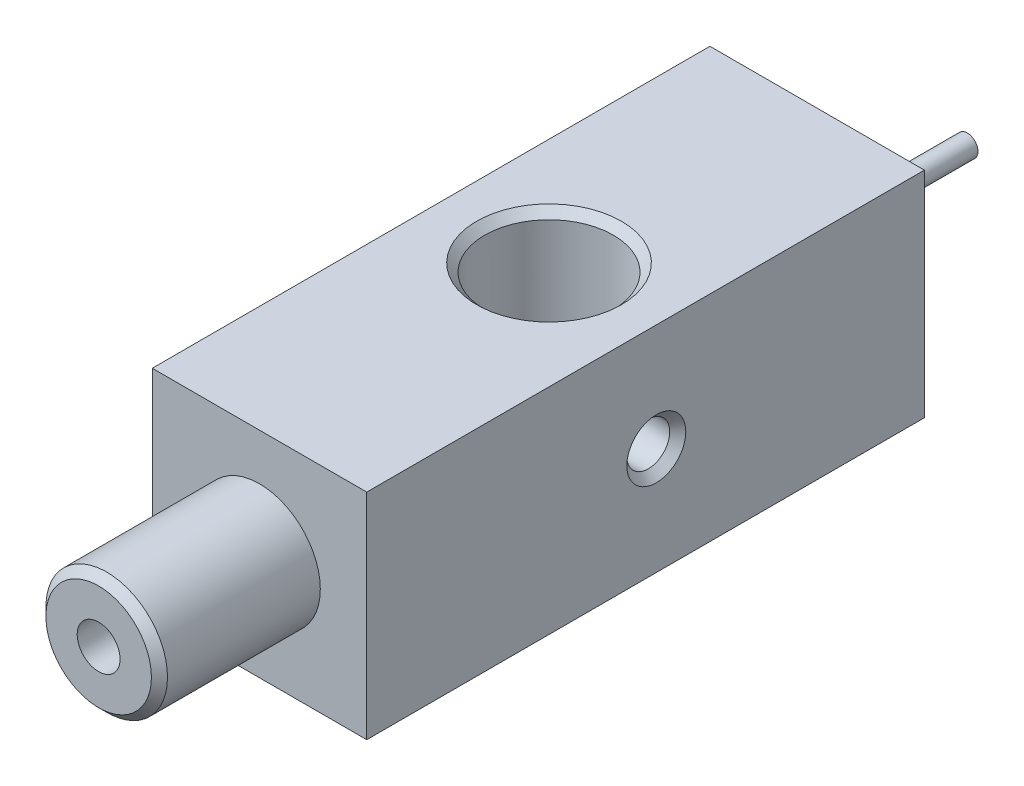
from build123d import *

# Parameters (mm, degrees)
CROQUIS1_W                               = 31.75
CROQUIS1_H                               = 31.75
SALIENTE_EXTRUIR1_DEPTH                  = 82.55
CORTAR_EXTRUIR2_REACH                    = 91.859
CROQUIS2_R                               = 9.525
CROQUIS3_R                               = 9
SALIENTE_EXTRUIR2_DEPTH                  = 23.812
CROQUIS4_R                               = 1.5875
CORTAR_EXTRUIR3_DEPTH                    = 14.288
CROQUIS7_W                               = 1.5875
CROQUIS7_H                               = 28.576
DI_METRO_START                           = -15.875
DI_METRO_DE_TALADRO_1_4_0_25_1_OUTLINE_R = 3.175
DI_METRO_DE_TALADRO_1_4_0_25_1_DEPTH     = 31.75
CHAFL_N2_SIZE                            = 1.190625
CHAFL_N3_SIZE                            = 1.190625
CHAFL_N4_SIZE                            = 1.190625
CHAFL_N5_SIZE                            = 1.190625


# Read off the part's stored shape, not the designer's step: Diámetro de taladro 1/4 (0.25)1
with BuildPart() as part:
    # Croquis1 → Saliente-Extruir1 (new body)
    with BuildSketch(Plane.XY):
        Rectangle(CROQUIS1_W, CROQUIS1_H)
    extrude(amount=SALIENTE_EXTRUIR1_DEPTH)

    # Croquis2 → Cortar-Extruir2 (cut, up to next)
    with BuildSketch(Plane(origin=(0, 15.875, 0), x_dir=(1, 0, 0), z_dir=(0, 1, 0)), mode=Mode.PRIVATE) as cortar_extruir2_sk1:
        with Locations(Location((0, -39.688, 0), (0, 0, 270))):
            Circle(CROQUIS2_R)
    cortar_extruir2_tool1 = extrude(cortar_extruir2_sk1.sketch, amount=-CORTAR_EXTRUIR2_REACH, mode=Mode.PRIVATE) & part.part
    add(cortar_extruir2_tool1.solids().sort_by_distance((0, 15.875, 39.688))[0], mode=Mode.SUBTRACT)

    # Croquis3 → Saliente-Extruir2 (add)
    with BuildSketch(Plane.XY.offset(82.55)):
        Circle(CROQUIS3_R)
    extrude(amount=SALIENTE_EXTRUIR2_DEPTH)

    # Croquis4 → Cortar-Extruir3 (cut)
    with BuildSketch(Plane(origin=(0, 0, 0), x_dir=(-1, 0, 0), z_dir=(0, 0, -1))):
        with Locations((-7.935, 7.935)):
            Circle(CROQUIS4_R)
        with Locations((7.94, -7.94)):
            Circle(CROQUIS4_R)
    extrude(amount=-CORTAR_EXTRUIR3_DEPTH, mode=Mode.SUBTRACT)

    # Croquis8 → Taladro roscado 1/4-201 (revolve, cut)
    with BuildSketch(Plane(origin=(0, 0, 106.362), x_dir=(0, -1, 0), z_dir=(1, 0, 0))):
        Polygon((0, 0), (0, 16.195732465), (3.175, 14.288), (3.175, 0), align=None)
    revolve(axis=Axis((0, 0, 112.712), (0, 0, -1)), mode=Mode.SUBTRACT)

    # Diámetro de taladro 1/4 (0.25)1 outline → Diámetro de taladro 1/4 (0.25)1 (cut)
    with BuildSketch(Plane.YZ.offset(DI_METRO_START)):
        with Locations((0, 39.688)):
            Circle(DI_METRO_DE_TALADRO_1_4_0_25_1_OUTLINE_R)
    extrude(amount=DI_METRO_DE_TALADRO_1_4_0_25_1_DEPTH, mode=Mode.SUBTRACT)

    # Chaflán2
    chafl_n2_edges = [part.edges().sort_by_distance(p)[0] for p in [
        (0, 15.875, 30.163),
    ]]
    chamfer(chafl_n2_edges, length=CHAFL_N2_SIZE)

    # Chaflán3
    chafl_n3_edges = [part.edges().sort_by_distance(p)[0] for p in [
        (0, -15.875, 30.163),
    ]]
    chamfer(chafl_n3_edges, length=CHAFL_N3_SIZE)

    # Chaflán4
    chafl_n4_edges = [part.edges().sort_by_distance(p)[0] for p in [
        (-9, 0, 106.362),
    ]]
    chamfer(chafl_n4_edges, length=CHAFL_N4_SIZE)

    # Chaflán5
    chafl_n5_edges = [part.edges().sort_by_distance(p)[0] for p in [
        (-15.875, -3.175, 39.688),
        (15.875, -3.175, 39.688),
    ]]
    chamfer(chafl_n5_edges, length=CHAFL_N5_SIZE)

    # Croquis11 → Taladro roscado 1/4-202 (revolve, cut)
    with BuildSketch(Plane.YZ):
        Polygon((0, 0), (0, 24.132732465), (3.175, 22.225), (3.175, 0), align=None)
    revolve(axis=Axis((0, 0, -6.35), (0, 0, 1)), mode=Mode.SUBTRACT)


with BuildPart() as body_2:
    # Croquis6 → Revolución1 (revolve)
    with BuildSketch(Plane(origin=(0, 7.935, 0), x_dir=(1, 0, 0), z_dir=(0, 1, 0)), mode=Mode.PRIVATE) as revoluci_n1_sk:
        Polygon((6.3475, 0), (6.3475, -14.288), (7.935, -14.288), (7.935, 14.288), (6.3475, 14.288), align=None)
    revolve(revoluci_n1_sk.sketch.rotate(Axis((7.935, 7.935, 14.288), (0, 0, -1)), 180), axis=Axis((7.935, 7.935, 14.288), (0, 0, -1)))


with BuildPart() as body_3:
    # Croquis7 → Revolución2 (revolve)
    with BuildSketch(Plane(origin=(0, -7.935, 0), x_dir=(-1, 0, 0), z_dir=(0, -1, 0)), mode=Mode.PRIVATE) as revoluci_n2_sk:
        with Locations((8.73375, 0)):
            Rectangle(CROQUIS7_W, CROQUIS7_H)
    revolve(revoluci_n2_sk.sketch.rotate(Axis((-7.94, -7.935, 14.288), (0, 0, -1)), 180), axis=Axis((-7.94, -7.935, 14.288), (0, 0, -1)))


solid = Compound([part.part, body_2.part, body_3.part])
